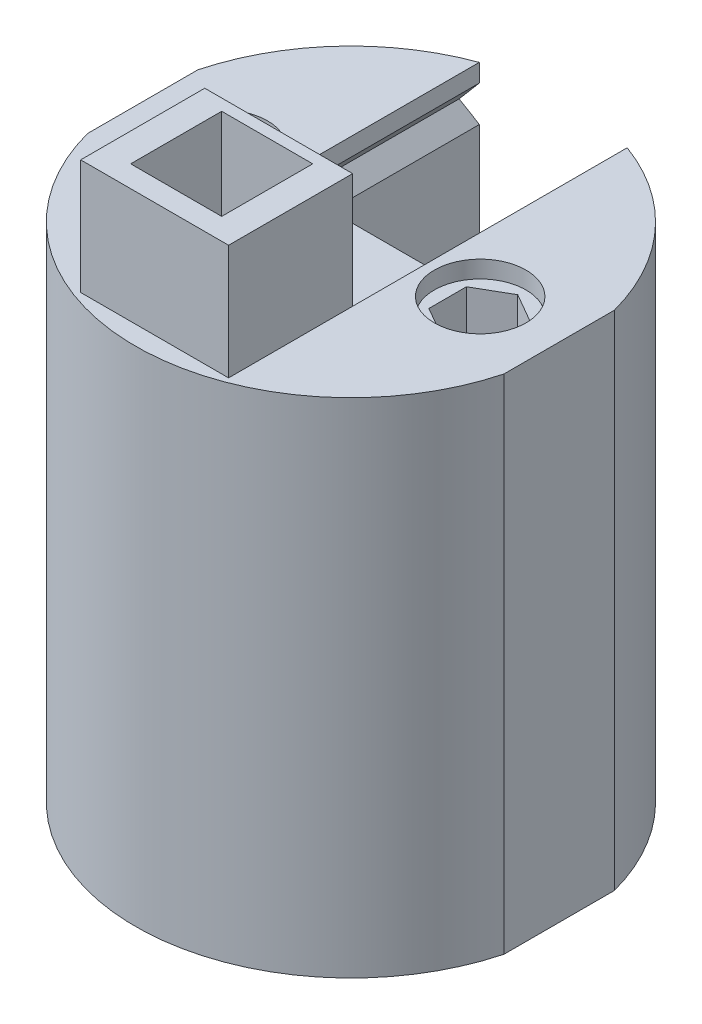
from build123d import *

# Parameters (mm, degrees)
SKETCH_1_R          = 15
EXTRUDE_1_DEPTH     = 35
SKETCH_2_R          = 1.4
CUT_EXTRUDE_1_DEPTH = 41.926763859
SKETCH_4_W          = 10.3
SKETCH_4_H          = 8.64
SKETCH_4_W_2        = 6.34
SKETCH_4_H_2        = 6.34
EXTRUDE_2_DEPTH     = 8
SKETCH_5_W          = 10.3
SKETCH_5_H          = 20.03
CUT_EXTRUDE_2_DEPTH = 5
CUT_EXTRUDE_3_DEPTH = 50.751390935
CUT_EXTRUDE_4_DEPTH = 37.742346142
SKETCH_8_W          = 2.3
SKETCH_8_H          = 6.34
EXTRUDE_3_DEPTH     = 1.6
SKETCH_10_W         = 2.02
SKETCH_10_H         = 3
SKETCH_11_W         = 6.34
SKETCH_11_H         = 6.34
CUT_EXTRUDE_5_DEPTH = 6.5
SKETCH_12_W         = 2.02
SKETCH_12_H         = 3
CUT_EXTRUDE_7_DEPTH = 5
SKETCH_16_R         = 3.19
CUT_EXTRUDE_8_DEPTH = 1.2
CUT_EXTRUDE_9_DEPTH = 41.926763859
CHAMFER_1_SIZE      = 1.1
CHAMFER_2_SIZE      = 1


with BuildPart() as part:
    # 草图1 → 凸台-拉伸1 (new body)
    with BuildSketch(Plane(origin=(0, 0, 0), x_dir=(1, 0, 0), z_dir=(0, 1, 0))):
        with Locations(Location((0, 0, 0), (0, 0, 270))):
            Circle(SKETCH_1_R)
    extrude(amount=EXTRUDE_1_DEPTH)

    # 草图2 → 切除-拉伸1 (cut, through all)
    with BuildSketch(Plane(origin=(0, 35, 0), x_dir=(1, 0, 0), z_dir=(0, 1, 0))):
        with Locations(Location((9, 0, 0), (0, 0, 270))):
            Circle(SKETCH_2_R)
        with Locations(Location((-9, 0, 0), (0, 0, 90))):
            Circle(SKETCH_2_R)
    extrude(amount=-CUT_EXTRUDE_1_DEPTH, mode=Mode.SUBTRACT)

    # 草图4 → 凸台-拉伸2 (add)
    with BuildSketch(Plane(origin=(0, 35, 0), x_dir=(1, 0, 0), z_dir=(0, 1, 0))):
        with Locations((0, -9.35)):
            Rectangle(SKETCH_4_W, SKETCH_4_H)
        with Locations((0, -9)):
            Rectangle(SKETCH_4_W_2, SKETCH_4_H_2, mode=Mode.SUBTRACT)
    extrude(amount=EXTRUDE_2_DEPTH)

    # 草图5 → 切除-拉伸2 (cut)
    with BuildSketch(Plane(origin=(0, 35, 0), x_dir=(1, 0, 0), z_dir=(0, 1, 0))):
        with Locations((0, 4.985)):
            Rectangle(SKETCH_5_W, SKETCH_5_H)
    extrude(amount=-CUT_EXTRUDE_2_DEPTH, mode=Mode.SUBTRACT)

    # 草图6 → 切除-拉伸3 (cut, through all)
    with BuildSketch(Plane(origin=(0, 0, 5.03), x_dir=(-1, 0, 0), z_dir=(0, 0, -1))):
        Polygon((-6.15, 32.5), (-5.15, 33.75), (-5.15, 31.25), align=None)
        Polygon((6.15, 32.5), (5.15, 33.75), (5.15, 31.25), align=None)
    extrude(amount=CUT_EXTRUDE_3_DEPTH, mode=Mode.SUBTRACT)

    # 草图7 → 切除-拉伸4 (cut, through all)
    with BuildSketch(Plane(origin=(0, 30, 0), x_dir=(1, 0, 0), z_dir=(0, 1, 0))):
        with BuildLine():
            Line((-5.15, 14.088204286), (-5.15, 4.97))
            Line((-5.15, 4.97), (5.15, 4.97))
            Line((5.15, 4.97), (5.15, 14.088204286))
            ThreePointArc((5.15, 14.088204286), (0, 15), (-5.15, 14.088204286))
        make_face()
    extrude(amount=-CUT_EXTRUDE_4_DEPTH, mode=Mode.SUBTRACT)

    # 草图8 → 凸台-拉伸3 (add)
    with BuildSketch(Plane(origin=(0, 35, 0), x_dir=(1, 0, 0), z_dir=(0, 1, 0))):
        with Locations((0, -9)):
            Rectangle(SKETCH_8_W, SKETCH_8_H)
    extrude(amount=EXTRUDE_3_DEPTH)

    # 切除-扫描1: sweep along a path in 草图9
    with BuildLine(Plane(origin=(0, 0, 0), x_dir=(0, 0, -1), z_dir=(1, 0, 0))) as sweep_1_path:
        Line((-9, 35), (-9, 27.97))
        Line((-9, 27.97), (-3.03, 22))
        Line((-3.03, 22), (4.97, 22))
    # 草图10 → 切除-扫描1 (sweep, cut)
    with BuildSketch(Plane(origin=(0, 35, 0), x_dir=(1, 0, 0), z_dir=(0, 1, 0))):
        with Locations((2.16, -9)):
            Rectangle(SKETCH_10_W, SKETCH_10_H)
        with Locations((-2.16, -9)):
            Rectangle(SKETCH_10_W, SKETCH_10_H)
    sweep(path=sweep_1_path.line, transition=Transition.RIGHT, mode=Mode.SUBTRACT)

    # 草图11 → 切除-拉伸5 (cut)
    with BuildSketch(Plane.XZ):
        with Locations((0, 9)):
            Rectangle(SKETCH_11_W, SKETCH_11_H)
    extrude(amount=-CUT_EXTRUDE_5_DEPTH, mode=Mode.SUBTRACT)

    # 切除-扫描2: sweep along a path in 草图13
    with BuildLine(Plane(origin=(0, 0, 0), x_dir=(0, 0, -1), z_dir=(1, 0, 0))) as sweep_2_path:
        Line((-9, 6.5), (-9, 13.5))
        Line((-9, 13.5), (-4.5, 18))
        Line((-4.5, 18), (4.97, 18))
    # 草图12 → 切除-扫描2 (sweep, cut)
    with BuildSketch(Plane.XZ.offset(-6.5)):
        with Locations((-2.16, 9)):
            Rectangle(SKETCH_12_W, SKETCH_12_H)
        with Locations((2.16, 9)):
            Rectangle(SKETCH_12_W, SKETCH_12_H)
    sweep(path=sweep_2_path.line, transition=Transition.RIGHT, mode=Mode.SUBTRACT)

    # 草图15 → 切除-拉伸7 (cut)
    with BuildSketch(Plane(origin=(0, 35, 0), x_dir=(1, 0, 0), z_dir=(0, 1, 0))):
        Polygon((9, 2.615396719), (6.735, 1.30769836), (6.735, -1.30769836), (9, -2.615396719), (11.265, -1.30769836), (11.265, 1.30769836), align=None)
        Polygon((-11.265, -1.30769836), (-11.265, 1.30769836), (-9, 2.615396719), (-6.735, 1.30769836), (-6.735, -1.30769836), (-9, -2.615396719), align=None)
    cut_extrude_7 = extrude(amount=-CUT_EXTRUDE_7_DEPTH, mode=Mode.SUBTRACT)

    # 草图16 → 切除-拉伸8 (cut)
    with BuildSketch(Plane(origin=(0, 35, 0), x_dir=(1, 0, 0), z_dir=(0, 1, 0))):
        with Locations(Location((9, 0, 0), (0, 0, 270))):
            Circle(SKETCH_16_R)
        with Locations(Location((-9, 0, 0), (0, 0, 90))):
            Circle(SKETCH_16_R)
    cut_extrude_8 = extrude(amount=-CUT_EXTRUDE_8_DEPTH, mode=Mode.SUBTRACT)

    # 镜向1: 切除-拉伸7, 切除-拉伸8 across plane
    add(cut_extrude_7.mirror(Plane.ZX.offset(17.5)), mode=Mode.SUBTRACT)
    add(cut_extrude_8.mirror(Plane.ZX.offset(17.5)), mode=Mode.SUBTRACT)

    # 草图17 → 切除-拉伸9 (cut, through all)
    with BuildSketch(Plane(origin=(0, 35, 0), x_dir=(1, 0, 0), z_dir=(0, 1, 0))):
        with BuildLine():
            Line((14.5, 3.840572874), (14.5, -3.840572874))
            ThreePointArc((14.5, -3.840572874), (15, 0), (14.5, 3.840572874))
        make_face()
        with BuildLine():
            Line((-14.5, 3.840572874), (-14.5, -3.840572874))
            ThreePointArc((-14.5, -3.840572874), (-15, 0), (-14.5, 3.840572874))
        make_face()
    extrude(amount=-CUT_EXTRUDE_9_DEPTH, mode=Mode.SUBTRACT)

    # 倒角1
    # the kernel refuses this chamfer: 1.1 mm, written as the material it adds along each edge
    with BuildSketch(Plane(origin=(-3.17, 19.5, 7.95017163), x_dir=(-0.027495876610586133, -0.9996219169112966, 0), z_dir=(0, 0, -1))) as chamfer_1_piece_1:
        Polygon((CHAMFER_1_SIZE * 0.999621916911, -CHAMFER_1_SIZE * 0.0274958766106), (-CHAMFER_1_SIZE * 0.0274958766106, -CHAMFER_1_SIZE * 0.999621916911), (0, 0), align=None)
    extrude(amount=12.92017163)
    with BuildSketch(Plane(origin=(-1.15, 19.5, 7.95017163), x_dir=(0.02749587661058633, -0.9996219169112966, 0), z_dir=(0, 0, -1)), Plane(origin=(3.17, 19.5, 7.95017163), x_dir=(0.027495876610586525, -0.9996219169112966, 0), z_dir=(0, 0, -1)), Plane(origin=(1.15, 19.5, 7.95017163), x_dir=(0.9996219169112966, 0.02749587661058971, 0), z_dir=(0, 0, -1))) as chamfer_1_piece_2:
        Polygon((CHAMFER_1_SIZE * 0.999621916911, CHAMFER_1_SIZE * 0.0274958766106), (-CHAMFER_1_SIZE * 0.0274958766106, CHAMFER_1_SIZE * 0.999621916911), (0, 0), align=None)
    extrude(amount=12.92017163)

    # 倒角2
    chamfer_2_edges = [part.edges().sort_by_distance(p)[0] for p in [
        (3.17, 23.5, -1.280660172),
        (1.15, 23.5, -1.280660172),
        (-1.15, 23.5, -1.280660172),
        (-3.17, 23.5, -1.280660172),
    ]]
    chamfer(chamfer_2_edges, length=CHAMFER_2_SIZE)


solid = part.part
